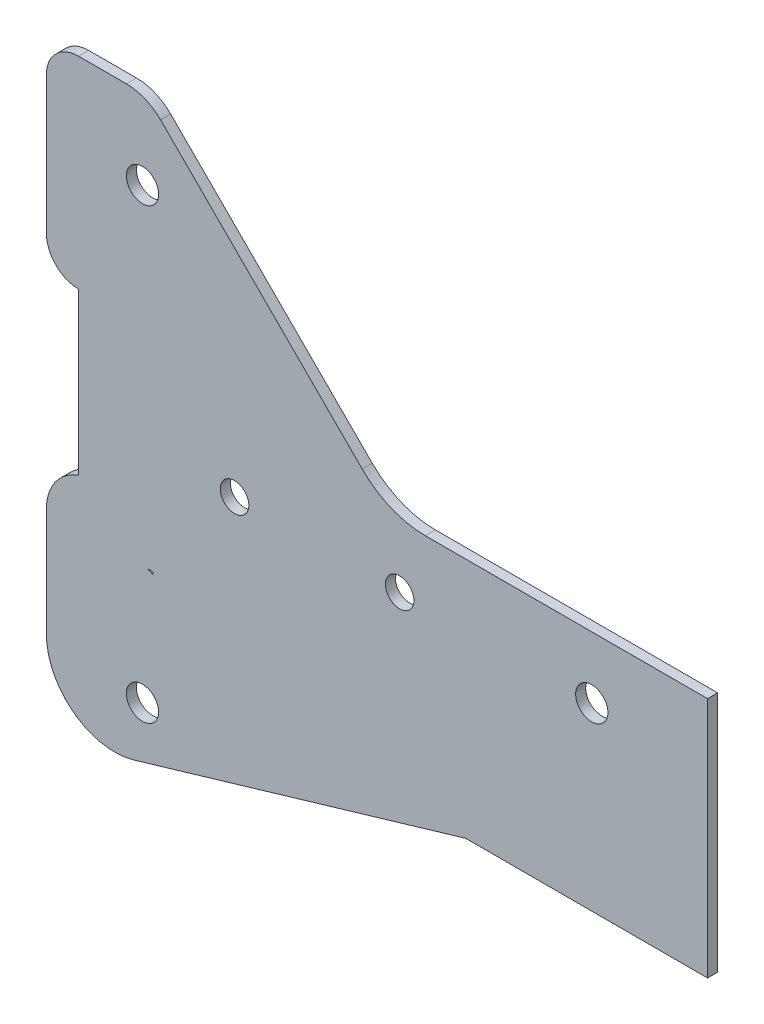
from build123d import *

# Parameters (mm, degrees)
SKETCH1_R           = 2.54
SKETCH1_R_2         = 2.25
BOSS_EXTRUDE1_DEPTH = 1.5875


with BuildPart() as part:
    # Sketch1 → Boss-Extrude1 (new body)
    with BuildSketch(Plane.XY):
        with BuildLine():
            Line((0, 0), (-44.45, 0))
            ThreePointArc((-44.45, 0), (-49.830627072, 1.070273269), (-54.392102448, 4.118153673))
            Line((-54.392102448, 4.118153673), (-86.142102448, 35.868153673))
            ThreePointArc((-86.142102448, 35.868153673), (-88.614208366, 37.519962038), (-91.530256121, 38.1))
            Line((-91.530256121, 38.1), (-99.06, 38.1))
            ThreePointArc((-99.06, 38.1), (-102.652102448, 36.612102448), (-104.14, 33.02))
            Line((-104.14, 33.02), (-104.14, 11.43))
            ThreePointArc((-104.14, 11.43), (-102.652102448, 7.837897552), (-99.06, 6.35))
            Line((-99.06, 6.35), (-99.06, -19.05))
            ThreePointArc((-99.06, -19.05), (-102.741703947, -21.834795846), (-104.14, -26.234204897))
            Line((-104.14, -26.234204897), (-104.14, -43.199318572))
            ThreePointArc((-104.14, -43.199318572), (-99.814124397, -51.831543955), (-90.309725681, -53.532990354))
            Line((-90.309725681, -53.532990354), (-38.1, -38.1))
            Line((-38.1, -38.1), (0, -38.1))
            Line((0, -38.1), (0, 0))
        make_face()
        with Locations((-89, 25.555)):
            Circle(SKETCH1_R, mode=Mode.SUBTRACT)
        with Locations((-89, -45.055)):
            Circle(SKETCH1_R, mode=Mode.SUBTRACT)
        with Locations((-18.24, -9.75)):
            Circle(SKETCH1_R, mode=Mode.SUBTRACT)
        with Locations((-74.5, -9.75)):
            Circle(SKETCH1_R_2, mode=Mode.SUBTRACT)
        with Locations((-48.5, -9.75)):
            Circle(SKETCH1_R_2, mode=Mode.SUBTRACT)
        with BuildLine():
            Line((-87.367456514, -26.384378352), (-87.367456514, -26.74700147))
            ThreePointArc((-87.367456514, -26.74700147), (-87.758152401, -26.560498587), (-88.145101392, -26.366341228))
            ThreePointArc((-88.145101392, -26.366341228), (-87.75638353, -26.379868464), (-87.367456514, -26.384378352))
        make_face(mode=Mode.SUBTRACT)
    extrude(amount=BOSS_EXTRUDE1_DEPTH)


solid = part.part
